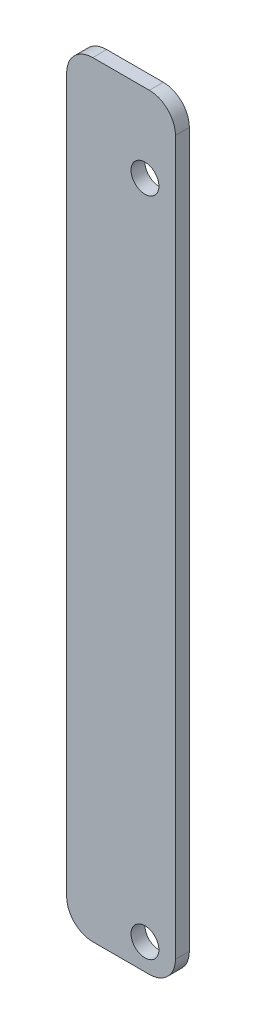
from build123d import *

# Parameters (mm, degrees)
SKETCH2_W                      = 12.5
SKETCH2_H                      = 88
BOSS_EXTRUDE1_DEPTH            = 1.6
F_3_2_3_2_DIAMETER_HOLE1_D     = 3.2
F_3_2_3_2_DIAMETER_HOLE1_DEPTH = 1.6
F_3_2_3_2_DIAMETER_HOLE1_TIP   = 0.96137699
FILLET1_R                      = 3


with BuildPart() as part:
    # Sketch2 → Boss-Extrude1 (new body)
    with BuildSketch(Plane.XY.offset(96.838346843)):
        with Locations((-53.102520427, -5.981220417)):
            Rectangle(SKETCH2_W, SKETCH2_H)
    extrude(amount=BOSS_EXTRUDE1_DEPTH)

    # Ø3.2 (3.2) Diameter Hole1
    with Locations(Plane.XY.offset(98.438346843)):
        with Locations((-50.352520427, 29.018779583), (-50.352520427, -46.981220417)):
            Hole(F_3_2_3_2_DIAMETER_HOLE1_D / 2, depth=F_3_2_3_2_DIAMETER_HOLE1_DEPTH)
            with Locations((0, 0, -(F_3_2_3_2_DIAMETER_HOLE1_DEPTH + F_3_2_3_2_DIAMETER_HOLE1_TIP / 2))):  # 118° drill point
                Cone(0, F_3_2_3_2_DIAMETER_HOLE1_D / 2, F_3_2_3_2_DIAMETER_HOLE1_TIP, mode=Mode.SUBTRACT)

    # Fillet1
    fillet1_edges = [part.edges().sort_by_distance(p)[0] for p in [
        (-46.852520427, 38.018779583, 97.638346843),
        (-59.352520427, 38.018779583, 97.638346843),
        (-46.852520427, -49.981220417, 97.638346843),
        (-59.352520427, -49.981220417, 97.638346843),
    ]]
    fillet(fillet1_edges, radius=FILLET1_R)


solid = part.part
